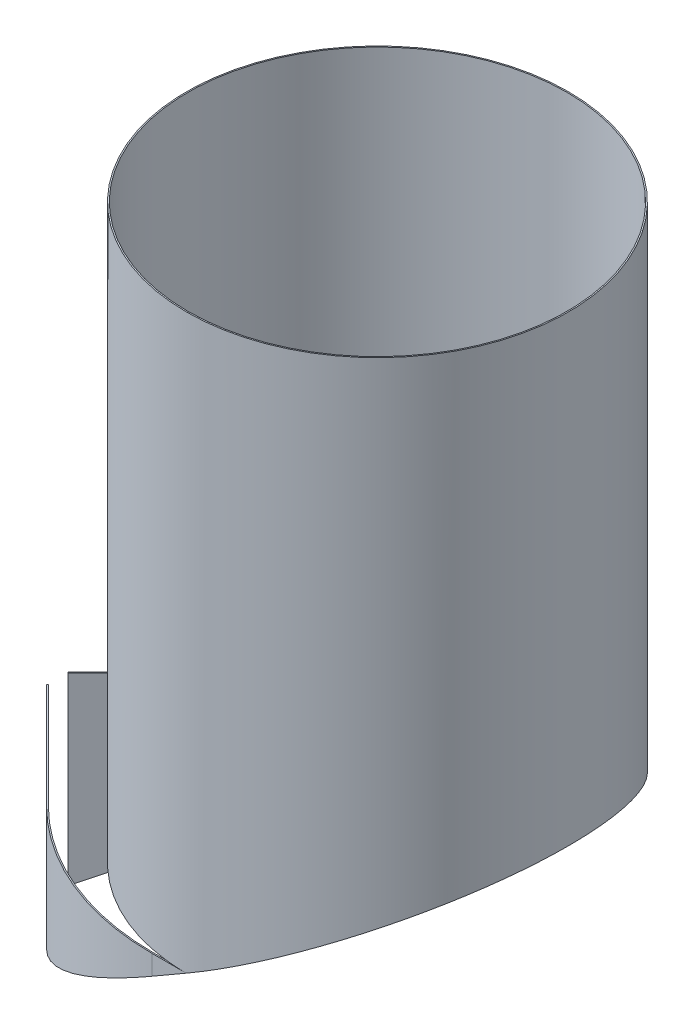
from build123d import *

# Parameters (mm, degrees)
BOSS_EXTRUDE1_DEPTH     = 600
CUT_EXTRUDE1_DEPTH      = 743.024258364
CUT_EXTRUDE1_DEPTH_BACK = 743.024258364
CUT_EXTRUDE2_START      = -450
CUT_EXTRUDE2_DEPTH      = 450
FILLET1_R               = 200
SHELL2_START            = 53.190392924
SHELL2_OUTLINE_R        = 149
SHELL2_DEPTH            = 546.809607076
SHELL2_START_2          = 5.290187796
SHELL2_2_DEPTH          = 144.709812204


# Read off the part's stored shape, not the designer's step: Shell2
with BuildPart() as part:
    # Sketch1 → Boss-Extrude1 (new body)
    with BuildSketch(Plane(origin=(0, 0, 0), x_dir=(1, 0, 0), z_dir=(0, 1, 0))):
        with BuildLine():
            Line((8.485281374, -8.485281374), (150, -150))
            Line((150, -150), (260, -150))
            ThreePointArc((260, -150), (410, 0), (260, 150))
            Line((260, 150), (150, 150))
            Line((150, 150), (8.485281374, 8.485281374))
            ThreePointArc((8.485281374, 8.485281374), (12, 0), (8.485281374, -8.485281374))
        make_face()
    extrude(amount=BOSS_EXTRUDE1_DEPTH)

    # Sketch2 → Cut-Extrude1 (cut, two sides: drawn at the far end of the back side and taken through both)
    with BuildSketch(Plane.XY.offset(-CUT_EXTRUDE1_DEPTH_BACK)):
        Polygon((0, 0), (410, 236.713610368), (410, 0), align=None)
    extrude(amount=CUT_EXTRUDE1_DEPTH + CUT_EXTRUDE1_DEPTH_BACK, mode=Mode.SUBTRACT)

    # Sketch3 → Cut-Extrude2 (cut)
    with BuildSketch(Plane(origin=(0, 600, 0), x_dir=(1, 0, 0), z_dir=(0, 1, 0)).offset(CUT_EXTRUDE2_START)):
        with BuildLine():
            Line((0, 0), (150, 150))
            Line((150, 150), (260, 150))
            ThreePointArc((260, 150), (110, 0), (260, -150))
            Line((260, -150), (150, -150))
            Line((150, -150), (0, 0))
        make_face()
    extrude(amount=CUT_EXTRUDE2_DEPTH, mode=Mode.SUBTRACT)

    # Fillet1
    fillet1_edges = [part.edges().sort_by_distance(p)[0] for p in [
        (150, 118.301270189, 150),
        (150, 118.301270189, -150),
    ]]
    fillet(fillet1_edges, radius=FILLET1_R)

    # Shell2 outline → Shell2 (cut)
    with BuildSketch(Plane(origin=(0, 0, 0), x_dir=(1, 0, 0), z_dir=(0, 1, 0)).offset(SHELL2_START)):
        with Locations((260, 0)):
            Circle(SHELL2_OUTLINE_R)
    extrude(amount=SHELL2_DEPTH, mode=Mode.SUBTRACT)

    # Shell2 2 outline → Shell2 2 (cut)
    with BuildSketch(Plane(origin=(0, 0, 0), x_dir=(1, 0, 0), z_dir=(0, 1, 0)).offset(SHELL2_START_2)):
        with BuildLine():
            Line((9.162874044, -7.748660481), (92.128463018, -90.714249456))
            ThreePointArc((92.128463018, -90.714249456), (156.688709434, -133.85202697), (232.842712475, -149))
            Line((232.842712475, -149), (260, -149))
            ThreePointArc((260, -149), (111, 0), (260, 149))
            Line((260, 149), (232.842712475, 149))
            ThreePointArc((232.842712475, 149), (156.688709434, 133.85202697), (92.128463018, 90.714249456))
            Line((92.128463018, 90.714249456), (9.162874044, 7.748660481))
            ThreePointArc((9.162874044, 7.748660481), (12, 0), (9.162874044, -7.748660481))
        make_face()
    extrude(amount=SHELL2_2_DEPTH, mode=Mode.SUBTRACT)


solid = part.part
